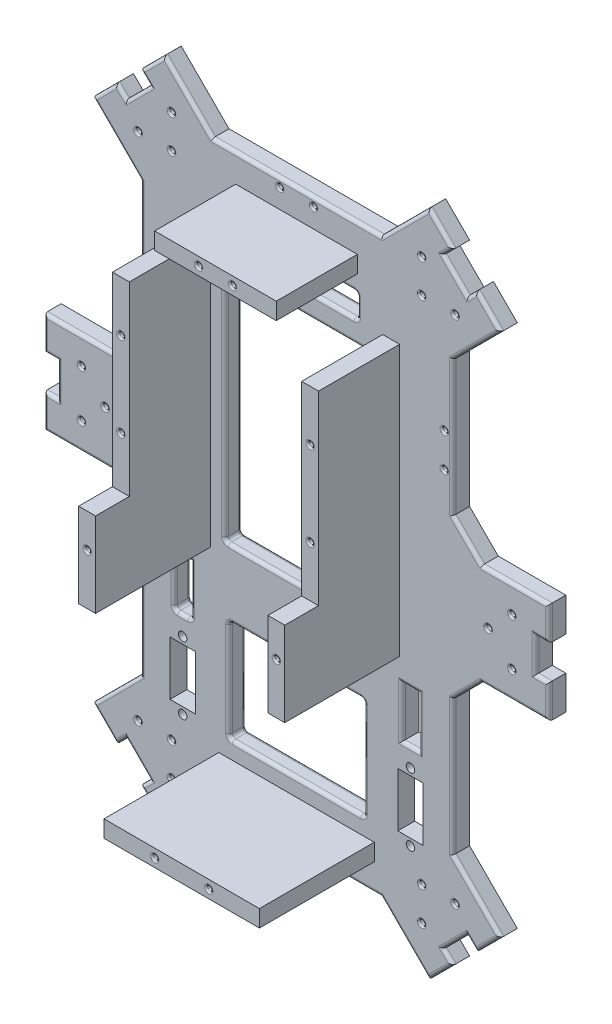
from build123d import *

# Parameters (mm, degrees)
DODANIE_WYCI_GNI_CIE1_DEPTH     = 5
WYTNIJ_WYCI_GNI_CIE7_DEPTH      = 42
WYTNIJ_WYCI_GNI_CIE7_DEPTH_BACK = 60
SZKIC11_R                       = 0.8
WYTNIJ_WYCI_GNI_CIE8_DEPTH      = 36
WYTNIJ_WYCI_GNI_CIE8_DEPTH_BACK = 66
SZKIC12_R                       = 0.75
WYTNIJ_WYCI_GNI_CIE9_DEPTH      = 54
WYTNIJ_WYCI_GNI_CIE9_DEPTH_BACK = 47
SZKIC13_R                       = 1.25
SZKIC13_W                       = 42.426406872
SZKIC13_H                       = 70
SZKIC13_W_2                     = 40
SZKIC13_H_2                     = 30
SZKIC13_W_3                     = 5
SZKIC13_H_3                     = 15
SZKIC13_W_4                     = 7.5
SZKIC13_H_4                     = 16
SZKIC13_W_5                     = 36
SZKIC13_H_5                     = 7
SZKIC14_W                       = 5
SZKIC14_H                       = 80
SZKIC14_R                       = 0.75
SZKIC14_W_2                     = 46
SZKIC14_H_2                     = 5
SZKIC14_W_3                     = 36
DODANIE_WYCI_GNI_CIE7_DEPTH     = 24
SZKIC14_9_W                     = 46
SZKIC14_9_H                     = 5
SZKIC14_9_R                     = 0.75
DODANIE_WYCI_GNI_CIE8_DEPTH     = 34
SZKIC17_W                       = 5
SZKIC17_H                       = 25
SZKIC17_R                       = 0.75
DODANIE_WYCI_GNI_CIE9_DEPTH     = 39
ZAOKR_GLENIE3_R                 = 1
ZAOKR_GLENIE4_R                 = 1
ZAOKR_GLENIE5_R                 = 0.5


with BuildPart() as part:
    # Szkic1 → Dodanie-wyciągnięcie1 (new body)
    with BuildSketch(Plane.XY):
        Polygon((0, 0), (-50, 0), (-64.142135624, 14.142135624), (-71.213203436, 7.071067812), (-68.384776311, 4.242640687), (-75.455844123, -2.828427125), (-78.284271247, 0), (-85.355339059, -7.071067812), (-71.213203436, -21.213203436), (-71.213203436, -61.213203436), (-79.69848481, -69.69848481), (-99.69848481, -69.69848481), (-99.69848481, -79.69848481), (-95.69848481, -79.69848481), (-95.69848481, -89.69848481), (-99.69848481, -89.69848481), (-99.69848481, -99.69848481), (-79.69848481, -99.69848481), (-71.213203436, -108.183766184), (-71.213203436, -148.183766184), (-85.355339059, -162.325901808), (-78.284271247, -169.39696962), (-75.455844123, -166.568542495), (-68.384776311, -173.639610307), (-71.213203436, -176.468037432), (-64.142135624, -183.539105243), (-50, -169.39696962), (0, -169.39696962), (14.142135624, -183.539105243), (21.213203436, -176.468037432), (18.384776311, -173.639610307), (25.455844123, -166.568542495), (28.284271247, -169.39696962), (35.355339059, -162.325901808), (21.213203436, -148.183766184), (21.213203436, -108.183766184), (29.69848481, -99.69848481), (49.69848481, -99.69848481), (49.69848481, -89.69848481), (45.69848481, -89.69848481), (45.69848481, -79.69848481), (49.69848481, -79.69848481), (49.69848481, -69.69848481), (29.69848481, -69.69848481), (21.213203436, -61.213203436), (21.213203436, -21.213203436), (35.355339059, -7.071067812), (28.284271247, 0), (25.455844123, -2.828427125), (18.384776311, 4.242640687), (21.213203436, 7.071067812), (14.142135624, 14.142135624), align=None)
    extrude(amount=DODANIE_WYCI_GNI_CIE1_DEPTH)

    # Szkic11 → Wytnij-wyciągnięcie7 (cut, two sides: drawn at the far end of the back side and taken through both)
    with BuildSketch(Plane.XY.offset(5).offset(-WYTNIJ_WYCI_GNI_CIE7_DEPTH_BACK)):
        with Locations((-81.69848481, -84.69848481)):
            Circle(SZKIC11_R)
        with Locations((-88.69848481, -77.69848481)):
            Circle(SZKIC11_R)
        with Locations((-88.69848481, -91.69848481)):
            Circle(SZKIC11_R)
        with Locations((-62.02081528, -9.192388155)):
            Circle(SZKIC11_R)
        with Locations((-62.02081528, 0.707106781)):
            Circle(SZKIC11_R)
        with Locations((-71.920310217, -9.192388155)):
            Circle(SZKIC11_R)
        with Locations((12.02081528, -9.192388155)):
            Circle(SZKIC11_R)
        with Locations((12.02081528, 0.707106781)):
            Circle(SZKIC11_R)
        with Locations((21.920310217, -9.192388155)):
            Circle(SZKIC11_R)
        with Locations((31.69848481, -84.69848481)):
            Circle(SZKIC11_R)
        with Locations((38.69848481, -77.69848481)):
            Circle(SZKIC11_R)
        with Locations((38.69848481, -91.69848481)):
            Circle(SZKIC11_R)
        with Locations((12.02081528, -160.204581464)):
            Circle(SZKIC11_R)
        with Locations((21.920310217, -160.204581464)):
            Circle(SZKIC11_R)
        with Locations((12.02081528, -170.104076401)):
            Circle(SZKIC11_R)
        with Locations((-62.02081528, -160.204581464)):
            Circle(SZKIC11_R)
        with Locations((-71.920310217, -160.204581464)):
            Circle(SZKIC11_R)
        with Locations((-62.02081528, -170.104076401)):
            Circle(SZKIC11_R)
    extrude(amount=WYTNIJ_WYCI_GNI_CIE7_DEPTH + WYTNIJ_WYCI_GNI_CIE7_DEPTH_BACK, mode=Mode.SUBTRACT)

    # Szkic12 → Wytnij-wyciągnięcie8 (cut, two sides: drawn at the far end of the back side and taken through both)
    with BuildSketch(Plane.XY.offset(5).offset(-WYTNIJ_WYCI_GNI_CIE8_DEPTH_BACK)):
        with Locations((-30, -2.5)):
            Circle(SZKIC12_R)
        with Locations((-20, -2.5)):
            Circle(SZKIC12_R)
        with Locations((-30, -166.89696962)):
            Circle(SZKIC12_R)
        with Locations((-20, -166.89696962)):
            Circle(SZKIC12_R)
        with Locations((-68.713203436, -40.5)):
            Circle(SZKIC12_R)
        with Locations((-68.713203436, -50.5)):
            Circle(SZKIC12_R)
        with Locations((18.713203436, -40.5)):
            Circle(SZKIC12_R)
        with Locations((18.713203436, -50.5)):
            Circle(SZKIC12_R)
    extrude(amount=WYTNIJ_WYCI_GNI_CIE8_DEPTH + WYTNIJ_WYCI_GNI_CIE8_DEPTH_BACK, mode=Mode.SUBTRACT)

    # Szkic13 → Wytnij-wyciągnięcie9 (cut, two sides: drawn at the far end of the back side and taken through both)
    with BuildSketch(Plane.XY.offset(-WYTNIJ_WYCI_GNI_CIE9_DEPTH_BACK)):
        with Locations((8.713203436, -132)):
            Circle(SZKIC13_R)
        with Locations((8.713203436, -152)):
            Circle(SZKIC13_R)
        with Locations((-58.713203436, -132)):
            Circle(SZKIC13_R)
        with Locations((-58.713203436, -152)):
            Circle(SZKIC13_R)
        with Locations((-25, -66.5)):
            Rectangle(SZKIC13_W, SZKIC13_H)
        with Locations((-25.003203436, -136.39696962)):
            Rectangle(SZKIC13_W_2, SZKIC13_H_2)
        with Locations((-58.713203436, -119)):
            Rectangle(SZKIC13_W_3, SZKIC13_H_3)
        with Locations((-58.713203436, -142)):
            Rectangle(SZKIC13_W_4, SZKIC13_H_4)
        with Locations((8.713203436, -142)):
            Rectangle(SZKIC13_W_4, SZKIC13_H_4)
        with Locations((-25.003203436, -21.5)):
            Rectangle(SZKIC13_W_5, SZKIC13_H_5)
        with Locations((8.713203436, -119)):
            Rectangle(SZKIC13_W_3, SZKIC13_H_3)
    extrude(amount=WYTNIJ_WYCI_GNI_CIE9_DEPTH + WYTNIJ_WYCI_GNI_CIE9_DEPTH_BACK, mode=Mode.SUBTRACT)

    # Szkic14 → Dodanie-wyciągnięcie7 (add)
    # profile 1 of 4: a face of its own
    with BuildSketch(Plane.XY.offset(5)):
        with Locations((-52.998203436, -65)):
            Rectangle(SZKIC14_W, SZKIC14_H)
        with Locations((-52.998203436, -40)):
            Circle(SZKIC14_R, mode=Mode.SUBTRACT)
        with Locations((-52.998203436, -65)):
            Circle(SZKIC14_R, mode=Mode.SUBTRACT)
        with Locations((-52.998203436, -90)):
            Circle(SZKIC14_R, mode=Mode.SUBTRACT)
    # profile 2 of 4: a face of its own
    with BuildSketch(Plane.XY.offset(5)):
        with Locations((3.001796564, -65)):
            Rectangle(SZKIC14_W, SZKIC14_H)
        with Locations((3.001796564, -40)):
            Circle(SZKIC14_R, mode=Mode.SUBTRACT)
        with Locations((3.001796564, -65)):
            Circle(SZKIC14_R, mode=Mode.SUBTRACT)
        with Locations((3.001796564, -90)):
            Circle(SZKIC14_R, mode=Mode.SUBTRACT)
    # profile 3 of 4: a face of its own
    with BuildSketch(Plane.XY.offset(5)):
        with Locations((-25.003203436, -158.89696962)):
            Rectangle(SZKIC14_W_2, SZKIC14_H_2)
        with Locations((-33.003203436, -158.89696962)):
            Circle(SZKIC14_R, mode=Mode.SUBTRACT)
        with Locations((-17.003203436, -158.89696962)):
            Circle(SZKIC14_R, mode=Mode.SUBTRACT)
    # profile 4 of 4: a face of its own
    with BuildSketch(Plane.XY.offset(5)):
        with Locations((-25.003203436, -10.69696962)):
            Rectangle(SZKIC14_W_3, SZKIC14_H_2)
        with Locations((-30.003203436, -10.69696962)):
            Circle(SZKIC14_R, mode=Mode.SUBTRACT)
        with Locations((-20.003203436, -10.69696962)):
            Circle(SZKIC14_R, mode=Mode.SUBTRACT)
    extrude(amount=DODANIE_WYCI_GNI_CIE7_DEPTH)

    # Szkic14<9> → Dodanie-wyciągnięcie8 (add)
    with BuildSketch(Plane.XY.offset(5)):
        with Locations((-25.003203436, -158.89696962)):
            Rectangle(SZKIC14_9_W, SZKIC14_9_H)
        with Locations((-33.003203436, -158.89696962)):
            Circle(SZKIC14_9_R, mode=Mode.SUBTRACT)
        with Locations((-17.003203436, -158.89696962)):
            Circle(SZKIC14_9_R, mode=Mode.SUBTRACT)
    extrude(amount=DODANIE_WYCI_GNI_CIE8_DEPTH)

    # Szkic17 → Dodanie-wyciągnięcie9 (add)
    # profile 1 of 2: a face of its own
    with BuildSketch(Plane.XY):
        with Locations((-52.998203436, -92.5)):
            Rectangle(SZKIC17_W, SZKIC17_H)
        with Locations((-52.998203436, -90)):
            Circle(SZKIC17_R, mode=Mode.SUBTRACT)
    # profile 2 of 2: a face of its own
    with BuildSketch(Plane.XY):
        with Locations((3.001796564, -92.5)):
            Rectangle(SZKIC17_W, SZKIC17_H)
        with Locations((3.001796564, -90)):
            Circle(SZKIC17_R, mode=Mode.SUBTRACT)
    extrude(amount=DODANIE_WYCI_GNI_CIE9_DEPTH)

    # Zaokrąglenie3
    zaokr_glenie3_edges = [part.edges().sort_by_distance(p)[0] for p in [
        (-97.69848481, -79.69848481, 5),
        (-95.69848481, -84.69848481, 5),
        (-97.69848481, -89.69848481, 5),
        (-99.69848481, -94.69848481, 5),
        (-89.69848481, -99.69848481, 5),
        (-75.455844123, -103.941125497, 5),
        (-71.213203436, -128.183766184, 5),
        (-78.284271247, -155.254833996, 5),
        (-76.870057685, -167.982756057, 5),
        (-69.798989873, -175.053823869, 5),
        (-81.819805153, -165.861435714, 5),
        (-71.920310217, -170.104076401, 5),
        (-67.67766953, -180.003571337, 5),
        (-57.071067812, -176.468037432, 5),
        (-25, -169.39696962, 5),
        (7.071067812, -176.468037432, 5),
        (17.67766953, -180.003571337, 5),
        (19.798989873, -175.053823869, 5),
        (21.920310217, -170.104076401, 5),
        (26.870057685, -167.982756057, 5),
        (31.819805153, -165.861435714, 5),
        (28.284271247, -155.254833996, 5),
        (21.213203436, -128.183766184, 5),
        (25.455844123, -103.941125497, 5),
        (39.69848481, -99.69848481, 5),
        (49.69848481, -94.69848481, 5),
        (47.69848481, -89.69848481, 5),
        (45.69848481, -84.69848481, 5),
        (47.69848481, -79.69848481, 5),
        (49.69848481, -74.69848481, 5),
        (39.69848481, -69.69848481, 5),
        (25.455844123, -65.455844123, 5),
        (21.213203436, -41.213203436, 5),
        (28.284271247, -14.142135624, 5),
        (31.819805153, -3.535533906, 5),
        (26.870057685, -1.414213562, 5),
        (21.920310217, 0.707106781, 5),
        (19.798989873, 5.656854249, 5),
        (17.67766953, 10.606601718, 5),
        (7.071067812, 7.071067812, 5),
        (-25, 0, 5),
        (-69.798989873, 5.656854249, 5),
        (-67.67766953, 10.606601718, 5),
        (-57.071067812, 7.071067812, 5),
        (-71.920310217, 0.707106781, 5),
        (-76.870057685, -1.414213562, 5),
        (-81.819805153, -3.535533906, 5),
        (-78.284271247, -14.142135624, 5),
        (-71.213203436, -41.213203436, 5),
        (-75.455844123, -65.455844123, 5),
        (-89.69848481, -69.69848481, 5),
        (-99.69848481, -74.69848481, 5),
    ]]
    fillet(zaokr_glenie3_edges, radius=ZAOKR_GLENIE3_R)

    # Zaokrąglenie4
    zaokr_glenie4_edges = [part.edges().sort_by_distance(p)[0] for p in [
        (-56.213203436, -119, 5),
        (-61.213203436, -119, 5),
        (-61.213203436, -119, 0),
        (-56.213203436, -119, 0),
        (-45.003203436, -136.39696962, 5),
        (-5.003203436, -136.39696962, 5),
        (-5.003203436, -136.39696962, 0),
        (-45.003203436, -136.39696962, 0),
        (-46.213203436, -66.5, 5),
        (-3.786796564, -66.5, 5),
        (-3.786796564, -66.5, 0),
        (-46.213203436, -66.5, 0),
        (-7.003203436, -21.5, 5),
        (-43.003203436, -21.5, 5),
        (-43.003203436, -21.5, 0),
        (-7.003203436, -21.5, 0),
        (-58.713203436, -126.5, 5),
        (-61.213203436, -126.5, 2.5),
        (-58.713203436, -126.5, 0),
        (-56.213203436, -126.5, 2.5),
        (-25.003203436, -151.39696962, 5),
        (-45.003203436, -151.39696962, 2.5),
        (-25.003203436, -151.39696962, 0),
        (-5.003203436, -151.39696962, 2.5),
        (-25.003203436, -121.39696962, 5),
        (-5.003203436, -121.39696962, 2.5),
        (-25.003203436, -121.39696962, 0),
        (-45.003203436, -121.39696962, 2.5),
        (-25, -101.5, 5),
        (-46.213203436, -101.5, 2.5),
        (-25, -101.5, 0),
        (-3.786796564, -101.5, 2.5),
        (-25, -31.5, 5),
        (-3.786796564, -31.5, 2.5),
        (-25, -31.5, 0),
        (-46.213203436, -31.5, 2.5),
        (-25.003203436, -18, 5),
        (-7.003203436, -18, 2.5),
        (-25.003203436, -18, 0),
        (-43.003203436, -18, 2.5),
        (-25.003203436, -25, 5),
        (-43.003203436, -25, 2.5),
        (-25.003203436, -25, 0),
        (-7.003203436, -25, 2.5),
        (-58.713203436, -111.5, 0),
        (-58.713203436, -111.5, 5),
        (8.713203436, -126.5, 5),
        (11.213203436, -119, 5),
        (8.713203436, -111.5, 5),
        (6.213203436, -119, 5),
    ]]
    fillet(zaokr_glenie4_edges, radius=ZAOKR_GLENIE4_R)

    # Zaokrąglenie5
    zaokr_glenie5_edges = [part.edges().sort_by_distance(p)[0] for p in [
        (11.22081528, -170.104076401, 5),
        (11.22081528, -160.204581464, 5),
        (21.120310217, -160.204581464, 5),
        (-20.75, -166.89696962, 5),
        (-30.75, -166.89696962, 5),
        (-62.82081528, -170.104076401, 5),
        (-62.82081528, -160.204581464, 5),
        (-72.720310217, -160.204581464, 5),
        (-69.463203436, -50.5, 5),
        (-69.463203436, -40.5, 5),
        (37.89848481, -91.69848481, 5),
        (30.89848481, -84.69848481, 5),
        (37.89848481, -77.69848481, 5),
        (17.963203436, -50.5, 5),
        (17.963203436, -40.5, 5),
        (21.120310217, -9.192388155, 5),
        (11.22081528, -9.192388155, 5),
        (-30.75, -2.5, 5),
        (-20.75, -2.5, 5),
        (11.22081528, 0.707106781, 5),
        (-62.82081528, -9.192388155, 5),
        (-72.720310217, -9.192388155, 5),
        (-62.82081528, 0.707106781, 5),
        (-89.49848481, -91.69848481, 5),
        (-82.49848481, -84.69848481, 5),
        (-89.49848481, -77.69848481, 5),
        (-20.753203436, -10.69696962, 29),
        (-30.753203436, -10.69696962, 29),
        (-33.753203436, -158.89696962, 39),
        (-17.753203436, -158.89696962, 39),
        (2.251796564, -90, 39),
        (2.251796564, -65, 29),
        (2.251796564, -40, 29),
        (-53.748203436, -90, 39),
        (-53.748203436, -65, 29),
        (-53.748203436, -40, 29),
    ]]
    fillet(zaokr_glenie5_edges, radius=ZAOKR_GLENIE5_R)


solid = part.part
